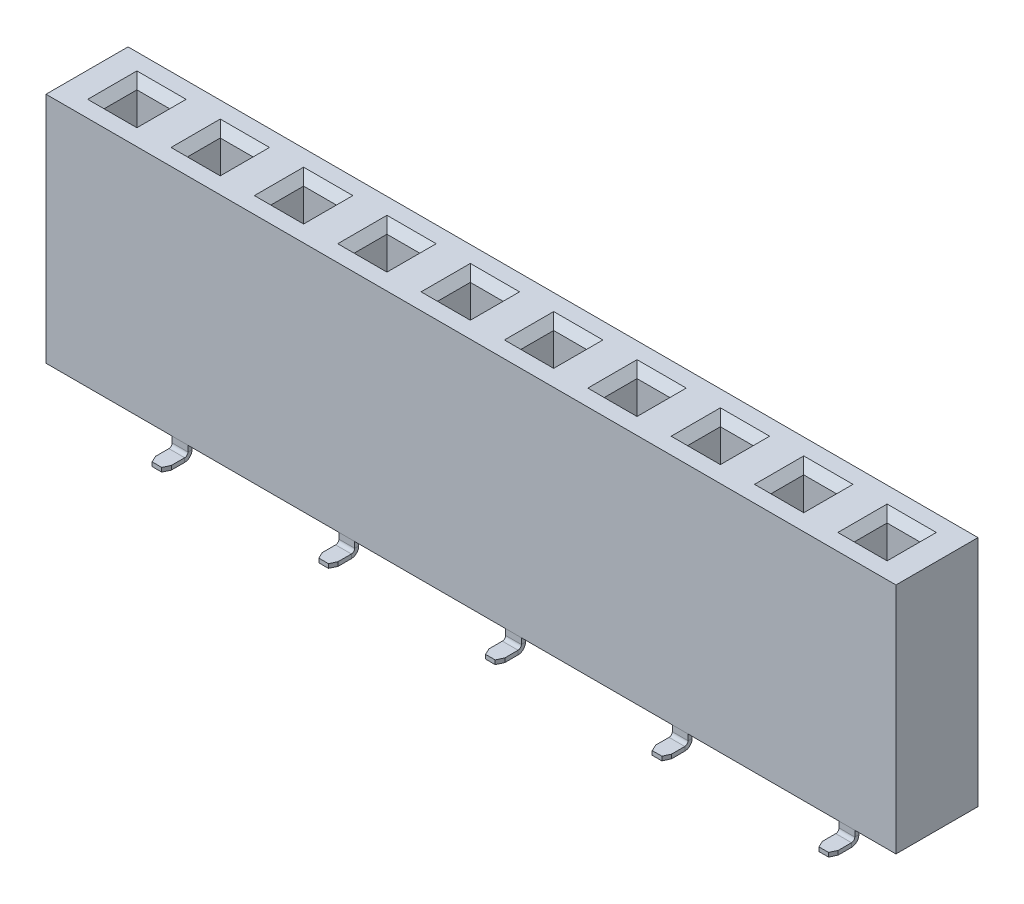
from build123d import *
from OCP.BRepFilletAPI import BRepFilletAPI_MakeChamfer

# Parameters (mm, degrees)
SKETCH1_W                  = 25.9
SKETCH1_H                  = 7.1
BOSS_EXTRUDE1_DEPTH        = 2.5
SKETCH2_W                  = 1
SKETCH2_H                  = 1
CUT_EXTRUDE1_DEPTH         = 2.5
CHAMFER1_SIZE              = 0.25
LPATTERN6_COUNT            = 10
LPATTERN6_PITCH            = 2.54
CHAMFER1_OF_LPATTERN6_SIZE = 0.25
BASE_FLANGE2_DEPTH         = 0.24
BASE_FLANGE2_DEPTH_BACK    = 0.24
BASE_FLANGE3_DEPTH         = 0.24
BASE_FLANGE3_DEPTH_BACK    = 0.24
CHAMFER3_SIZE              = 0.2
CHAMFER3_SIZE2             = 0.093261532
CHAMFER4_SIZE              = 0.2
CHAMFER4_SIZE2             = 0.093261532
LPATTERN4_COUNT            = 5
LPATTERN4_PITCH            = 5.08
LPATTERN3_COUNT            = 5
LPATTERN3_PITCH            = 5.08


# Sheet-metal steps are written as plain solids
with BuildPart() as part:
    # Sketch1 → Boss-Extrude1 (new body)
    with BuildSketch(Plane.XY):
        Rectangle(SKETCH1_W, SKETCH1_H)
    extrude(amount=BOSS_EXTRUDE1_DEPTH)

    # Sketch2 → Cut-Extrude1 (cut)
    with BuildSketch(Plane(origin=(0, 3.55, 0), x_dir=(1, 0, 0), z_dir=(0, 1, 0))):
        with Locations((-11.43, -1.25)):
            Rectangle(SKETCH2_W, SKETCH2_H)
    cut_extrude1 = extrude(amount=-CUT_EXTRUDE1_DEPTH, mode=Mode.SUBTRACT)

    # Chamfer1
    chamfer1_edges = [part.edges().sort_by_distance(p)[0] for p in [
        (-10.93, 3.55, 1.25),
        (-11.43, 3.55, 0.75),
        (-11.93, 3.55, 1.25),
        (-11.43, 3.55, 1.75),
    ]]
    chamfer(chamfer1_edges, length=CHAMFER1_SIZE)

    # LPattern6: Cut-Extrude1 ×10
    with Locations(*[(i * LPATTERN6_PITCH, 0, 0) for i in range(1, LPATTERN6_COUNT)]):
        add(cut_extrude1, mode=Mode.SUBTRACT)

    # Chamfer1 of LPattern6
    chamfer1_of_lpattern6_edges = [part.edges().sort_by_distance(p)[0] for p in [
        (-8.39, 3.55, 1.25),
        (-8.89, 3.55, 0.75),
        (-9.39, 3.55, 1.25),
        (-8.89, 3.55, 1.75),
        (-5.85, 3.55, 1.25),
        (-6.35, 3.55, 0.75),
        (-6.85, 3.55, 1.25),
        (-6.35, 3.55, 1.75),
        (-3.31, 3.55, 1.25),
        (-3.81, 3.55, 0.75),
        (-4.31, 3.55, 1.25),
        (-3.81, 3.55, 1.75),
        (-0.77, 3.55, 1.25),
        (-1.27, 3.55, 0.75),
        (-1.77, 3.55, 1.25),
        (-1.27, 3.55, 1.75),
        (1.77, 3.55, 1.25),
        (1.27, 3.55, 0.75),
        (0.77, 3.55, 1.25),
        (1.27, 3.55, 1.75),
        (4.31, 3.55, 1.25),
        (3.81, 3.55, 0.75),
        (3.31, 3.55, 1.25),
        (3.81, 3.55, 1.75),
        (6.85, 3.55, 1.25),
        (6.35, 3.55, 0.75),
        (5.85, 3.55, 1.25),
        (6.35, 3.55, 1.75),
        (9.39, 3.55, 1.25),
        (8.89, 3.55, 0.75),
        (8.39, 3.55, 1.25),
        (8.89, 3.55, 1.75),
        (11.93, 3.55, 1.25),
        (11.43, 3.55, 0.75),
        (10.93, 3.55, 1.25),
        (11.43, 3.55, 1.75),
    ]]
    chamfer(chamfer1_of_lpattern6_edges, length=CHAMFER1_OF_LPATTERN6_SIZE)


with BuildPart() as body_2:
    # Sketch5 → Base-Flange2 (new, two sides: drawn at the far end of the back side and taken through both)
    with BuildSketch(Plane.ZY.offset(11.43).offset(-BASE_FLANGE2_DEPTH_BACK)):
        with BuildLine():
            Line((0.15, -3.55), (0.15, -3.755))
            ThreePointArc((0.15, -3.755), (0.084099026, -3.914099026), (-0.075, -3.98))
            Line((-0.075, -3.98), (-0.68, -3.98))
            Line((-0.68, -3.98), (-0.68, -3.855))
            Line((-0.68, -3.855), (-0.075, -3.855))
            ThreePointArc((-0.075, -3.855), (-0.004289322, -3.825710678), (0.025, -3.755))
            Line((0.025, -3.755), (0.025, -3.55))
            Line((0.025, -3.55), (0.15, -3.55))
        make_face()
    extrude(amount=BASE_FLANGE2_DEPTH + BASE_FLANGE2_DEPTH_BACK)

    # Chamfer4: one chamfer whose edges measure the first distance from different faces: ONE call of the kernel's chamfer builder (chamfer() names one face for all edges)
    chamfer4_edges_1 = [body_2.edges().sort_by_distance(p)[0] for p in [
        (-11.19, -3.9175, -0.68),
    ]]
    chamfer4_side_1 = [body_2.faces().sort_by_distance(p)[0] for p in [
        (-11.19, -3.6525, 0.034347727),
    ]]
    chamfer4_edges_2 = [body_2.edges().sort_by_distance(p)[0] for p in [
        (-11.67, -3.9175, -0.68),
    ]]
    chamfer4_side_2 = [body_2.faces().sort_by_distance(p)[0] for p in [
        (-11.67, -3.6525, 0.034347727),
    ]]
    chamfer4 = BRepFilletAPI_MakeChamfer(body_2.part.solid().wrapped)
    for e in chamfer4_edges_1:
        chamfer4.Add(CHAMFER4_SIZE, CHAMFER4_SIZE2, e.wrapped, chamfer4_side_1[0].wrapped)  # the first distance lies on this face
    for e in chamfer4_edges_2:
        chamfer4.Add(CHAMFER4_SIZE, CHAMFER4_SIZE2, e.wrapped, chamfer4_side_2[0].wrapped)  # the first distance lies on this face
    add(Compound.cast(chamfer4.Shape()), mode=Mode.REPLACE)


with BuildPart() as body_3:
    # Sketch22 → Base-Flange3 (new, two sides: drawn at the far end of the back side and taken through both)
    with BuildSketch(Plane.ZY.offset(8.89).offset(-BASE_FLANGE3_DEPTH_BACK)):
        with BuildLine():
            Line((2.35, -3.55), (2.35, -3.755))
            ThreePointArc((2.35, -3.755), (2.415900974, -3.914099026), (2.575, -3.98))
            Line((2.575, -3.98), (3.18, -3.98))
            Line((3.18, -3.98), (3.18, -3.855))
            Line((3.18, -3.855), (2.575, -3.855))
            ThreePointArc((2.575, -3.855), (2.504289322, -3.825710678), (2.475, -3.755))
            Line((2.475, -3.755), (2.475, -3.55))
            Line((2.475, -3.55), (2.35, -3.55))
        make_face()
    extrude(amount=BASE_FLANGE3_DEPTH + BASE_FLANGE3_DEPTH_BACK)

    # Chamfer3: one chamfer whose edges measure the first distance from different faces: ONE call of the kernel's chamfer builder (chamfer() names one face for all edges)
    chamfer3_edges_1 = [body_3.edges().sort_by_distance(p)[0] for p in [
        (-8.65, -3.9175, 3.18),
    ]]
    chamfer3_side_1 = [body_3.faces().sort_by_distance(p)[0] for p in [
        (-8.65, -3.6525, 2.465652273),
    ]]
    chamfer3_edges_2 = [body_3.edges().sort_by_distance(p)[0] for p in [
        (-9.13, -3.9175, 3.18),
    ]]
    chamfer3_side_2 = [body_3.faces().sort_by_distance(p)[0] for p in [
        (-9.13, -3.6525, 2.465652273),
    ]]
    chamfer3 = BRepFilletAPI_MakeChamfer(body_3.part.solid().wrapped)
    for e in chamfer3_edges_1:
        chamfer3.Add(CHAMFER3_SIZE, CHAMFER3_SIZE2, e.wrapped, chamfer3_side_1[0].wrapped)  # the first distance lies on this face
    for e in chamfer3_edges_2:
        chamfer3.Add(CHAMFER3_SIZE, CHAMFER3_SIZE2, e.wrapped, chamfer3_side_2[0].wrapped)  # the first distance lies on this face
    add(Compound.cast(chamfer3.Shape()), mode=Mode.REPLACE)


with BuildPart() as lpattern4_1:
    # LPattern4: pattern copy
    add(body_2.part.moved(Location(Vector(1, 0, 0) * (1 * LPATTERN4_PITCH))))


with BuildPart() as lpattern4_2:
    # LPattern4: pattern copy
    add(body_2.part.moved(Location(Vector(1, 0, 0) * (2 * LPATTERN4_PITCH))))


with BuildPart() as lpattern4_3:
    # LPattern4: pattern copy
    add(body_2.part.moved(Location(Vector(1, 0, 0) * (3 * LPATTERN4_PITCH))))


with BuildPart() as lpattern4_4:
    # LPattern4: pattern copy
    add(body_2.part.moved(Location(Vector(1, 0, 0) * (4 * LPATTERN4_PITCH))))


with BuildPart() as lpattern3_1:
    # LPattern3: pattern copy
    add(body_3.part.moved(Location(Vector(1, 0, 0) * (1 * LPATTERN3_PITCH))))


with BuildPart() as lpattern3_2:
    # LPattern3: pattern copy
    add(body_3.part.moved(Location(Vector(1, 0, 0) * (2 * LPATTERN3_PITCH))))


with BuildPart() as lpattern3_3:
    # LPattern3: pattern copy
    add(body_3.part.moved(Location(Vector(1, 0, 0) * (3 * LPATTERN3_PITCH))))


with BuildPart() as lpattern3_4:
    # LPattern3: pattern copy
    add(body_3.part.moved(Location(Vector(1, 0, 0) * (4 * LPATTERN3_PITCH))))


solid = Compound([part.part, body_2.part, body_3.part, lpattern4_1.part, lpattern4_2.part, lpattern4_3.part, lpattern4_4.part, lpattern3_1.part, lpattern3_2.part, lpattern3_3.part, lpattern3_4.part])
